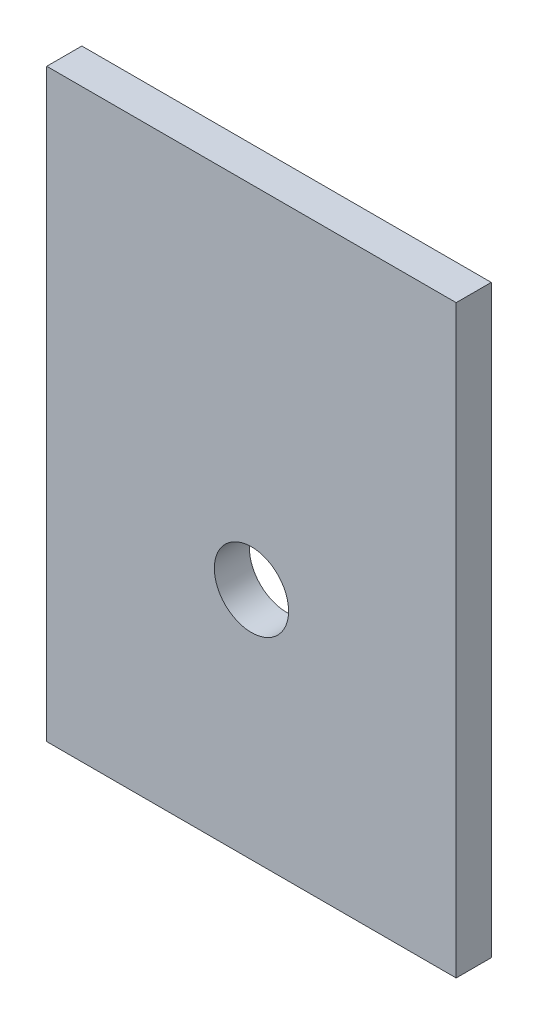
from build123d import *

# Parameters (mm, degrees)
SKETCH1_W           = 35
SKETCH1_H           = 50
BOSS_EXTRUDE1_DEPTH = 3
SKETCH2_R           = 3.175
CUT_EXTRUDE1_DEPTH  = 62.10646447


with BuildPart() as part:
    # Sketch1 → Boss-Extrude1 (new body)
    with BuildSketch(Plane.XY):
        with Locations((17.5, -25)):
            Rectangle(SKETCH1_W, SKETCH1_H)
    extrude(amount=BOSS_EXTRUDE1_DEPTH)

    # Sketch2 → Cut-Extrude1 (cut, through all)
    with BuildSketch(Plane.XY.offset(3)):
        with Locations((17.5, -30)):
            Circle(SKETCH2_R)
    extrude(amount=-CUT_EXTRUDE1_DEPTH, mode=Mode.SUBTRACT)


solid = part.part
